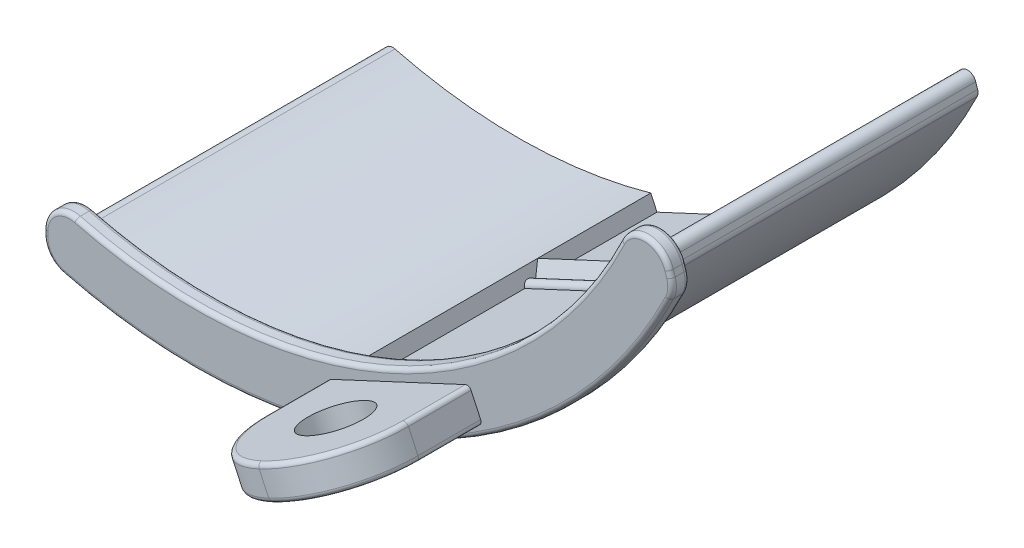
from build123d import *

# Parameters (mm, degrees)
BASE_EXTRUDE_DEPTH  = 2
BOSS_EXTRUDE1_DEPTH = 37.16
BOSS_EXTRUDE2_DEPTH = 16.2
FILLET1_R           = 9
SKETCH4_R           = 3.52
CUT_EXTRUDE1_DEPTH  = 64.580171374
FILLET3_R           = 0.5
CUT_EXTRUDE3_START  = -35.16
CUT_EXTRUDE3_DEPTH  = 35.16
BOSS_EXTRUDE3_REACH = 89.266


# Read off the part's stored shape, not the designer's step: Cut-Extrude3
with BuildPart() as part:
    # Sketch1 → Base-Extrude (new body)
    with BuildSketch(Plane.XY):
        with BuildLine():
            Line((54.84113201, -24.576058398), (54.628473973, -23.914611391))
            ThreePointArc((54.628473973, -23.914611391), (51.976550593, -21.839785691), (49.067516522, -23.535403595))
            ThreePointArc((49.067516522, -23.535403595), (22.988082213, -49.326306127), (-13.533918495, -52.710240468))
            ThreePointArc((-13.533918495, -52.710240468), (-16.11871633, -53.245518126), (-17.28, -55.61598691))
            Line((-17.28, -55.61598691), (-17.28, -56.111421297))
            ThreePointArc((-17.28, -56.111421297), (-16.648511043, -57.952658773), (-15.019896373, -59.018748826))
            ThreePointArc((-15.019896373, -59.018748826), (25.543504513, -55.284169318), (54.678638299, -26.815229139))
            ThreePointArc((54.678638299, -26.815229139), (54.977241057, -25.711417004), (54.84113201, -24.576058398))
        make_face()
    extrude(amount=BASE_EXTRUDE_DEPTH)

    # Sketch2 → Boss-Extrude1 (add)
    with BuildSketch(Plane.XY.offset(2)):
        with BuildLine():
            Line((-15.28, -55.61598691), (-15.28, -56.111421297))
            ThreePointArc((-15.28, -56.111421297), (-15.069503681, -56.725167122), (-14.526632124, -57.080530473))
            ThreePointArc((-14.526632124, -57.080530473), (24.70463737, -53.468597255), (52.882952312, -25.934597641))
            ThreePointArc((52.882952312, -25.934597641), (52.982486565, -25.566660262), (52.937116882, -25.188207393))
            Line((52.937116882, -25.188207393), (52.724458845, -24.526760386))
            ThreePointArc((52.724458845, -24.526760386), (51.840484385, -23.83515182), (50.870806361, -24.400357788))
            ThreePointArc((50.870806361, -24.400357788), (23.832921691, -51.139106794), (-14.031306165, -54.647404763))
            ThreePointArc((-14.031306165, -54.647404763), (-14.892905443, -54.825830649), (-15.28, -55.61598691))
        make_face()
    extrude(amount=-BOSS_EXTRUDE1_DEPTH)

    # Sketch3 → Boss-Extrude2 (add)
    with BuildSketch(Plane.XY.offset(2)):
        Polygon((31.667200425, -46.643561321), (33.187911486, -49.906602521), (16.872705491, -57.510157828), (15.351994429, -54.247116629), align=None)
    extrude(amount=BOSS_EXTRUDE2_DEPTH)

    # Fillet1
    fillet1_edges = [part.edges().sort_by_distance(p)[0] for p in [
        (16.11234996, -55.878637228, 18.2),
        (32.427555956, -48.275081921, 18.2),
    ]]
    fillet(fillet1_edges, radius=FILLET1_R - 0.0001)  # a hair under: the kernel refuses the full size

    # Sketch4 → Cut-Extrude1 (cut, through all)
    with BuildSketch(Plane(origin=(25.030308488, -53.708380174, 0), x_dir=(0.9064003331019249, 0.4224197393028875, 0), z_dir=(0.42241973930288756, -0.906400333101925, 0))):
        with Locations((0, 9.2)):
            Circle(SKETCH4_R)
    extrude(amount=-CUT_EXTRUDE1_DEPTH, mode=Mode.SUBTRACT)

    # Fillet3
    fillet3_edges = [part.edges().sort_by_distance(p)[0] for p in [
        (54.977241057, -25.711417004, 2),
        (25.543504513, -55.284169318, 0),
        (-16.648511043, -57.952658773, 0),
        (54.734802991, -24.245334894, 2),
        (51.976550593, -21.839785691, 2),
        (22.988082213, -49.326306127, 2),
        (-16.11871633, -53.245518126, 2),
        (-17.28, -55.863704104, 2),
        (-16.648511043, -57.952658773, 2),
        (25.543504513, -55.284169318, 2),
        (16.872705491, -57.510157828, 5.60005),
        (15.351994429, -54.247116629, 5.60005),
        (31.667200425, -46.643561321, 5.60005),
        (29.277920373, -47.757063843, 15.56399032),
        (17.741274481, -53.133614107, 15.56399032),
        (33.187911486, -49.906602521, 5.60005),
        (30.798631434, -51.020105042, 15.56399032),
        (-17.28, -55.863704104, 0),
        (19.261985543, -56.396655306, 15.56399032),
        (-16.11871633, -53.245518126, 0),
        (22.988082213, -49.326306127, 0),
        (51.976550593, -21.839785691, 0),
        (54.734802991, -24.245334894, 0),
        (54.977241057, -25.711417004, 0),
    ]]
    fillet(fillet3_edges, radius=FILLET3_R)

    # Cut-Extrude3 outline → Cut-Extrude3 (cut)
    with BuildSketch(Plane(origin=(0, 0, -35.16), x_dir=(-1, 0, 0), z_dir=(0, 0, -1)).offset(CUT_EXTRUDE3_START)):
        with BuildLine():
            Line((-31.685344985, -46.682494719), (-32.404496034, -48.225601466))
            Line((-32.404496034, -48.225601466), (-16.089290038, -55.829156774))
            Line((-16.089290038, -55.829156774), (-15.370138989, -54.286050026))
            ThreePointArc((-15.370138989, -54.286050026), (-23.832921691, -51.139106794), (-31.685344985, -46.682494719))
        make_face()
    extrude(amount=CUT_EXTRUDE3_DEPTH, mode=Mode.SUBTRACT)

    # Sketch7 → Boss-Extrude3 (add, up to next)
    with BuildSketch(Plane(origin=(8.157602998, 3.801777654, 0), x_dir=(0, 0, 1), z_dir=(-0.9064003331019256, -0.42241973930288634, 0)), mode=Mode.PRIVATE) as boss_extrude3_sk1:
        with BuildLine():
            Line((-25.66, -57.4), (-22.16, -55.697543931))
            Line((-22.16, -55.697543931), (-21.16, -57.4))
            ThreePointArc((-21.16, -57.4), (-20.56, -56.8), (-19.96, -57.4))
            Line((-19.96, -57.4), (-21.16, -57.566686604))
            Line((-21.16, -57.566686604), (-25.66, -57.4))
        make_face()
    boss_extrude3_tool1 = extrude(boss_extrude3_sk1.sketch, amount=BOSS_EXTRUDE3_REACH, mode=Mode.PRIVATE) - part.part
    add(boss_extrude3_tool1.solids().sort_by_distance((32.205788, -47.799227, -22.639326))[0])
    add(boss_extrude3_tool1.solids().sort_by_distance((32.205788, -47.799227, -22.639326))[1])


solid = part.part
